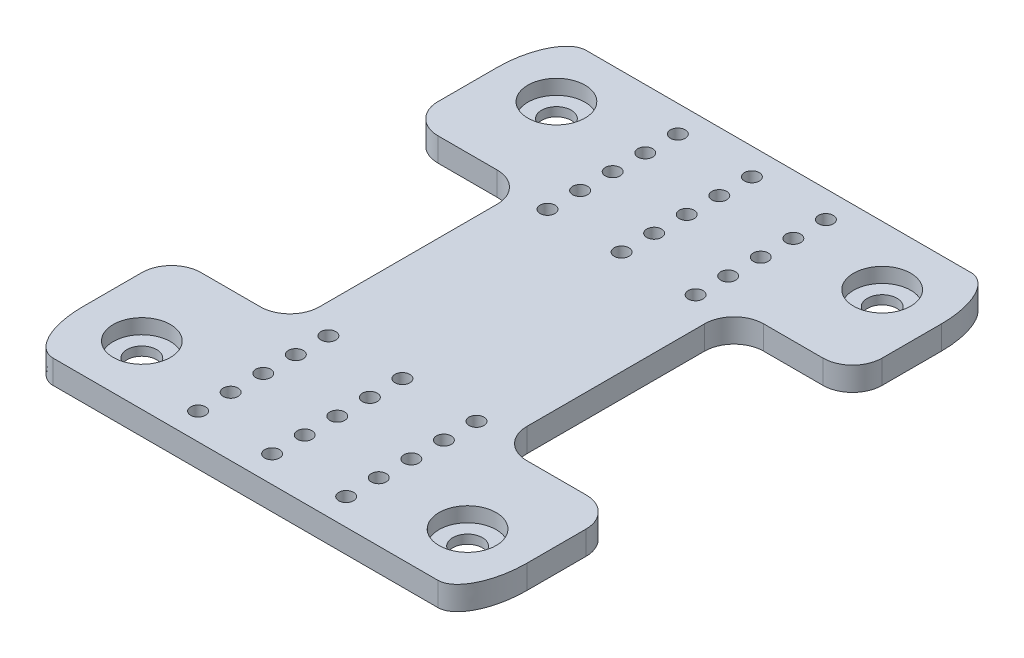
from build123d import *

# Parameters (mm, degrees)
SKETCH2_W               = 150
SKETCH2_H               = 180
BOSS_EXTRUDE1_DEPTH     = 4
FILLET1_SIZE            = 10
FILLET1_SIZE_2          = 20
FILLET2_SIZE            = 10
FILLET2_SIZE_2          = 20
SKETCH3_R               = 9.65
CUT_EXTRUDE1_DEPTH      = 5
SKETCH7_R               = 5
CUT_EXTRUDE4_DEPTH      = 118.426572949
MIRROR2_COPY_1_SKETCH_R = 9.65
MIRROR2_COPY_1_DEPTH    = 5
MIRROR2_COPY_2_SKETCH_R = 5
MIRROR2_COPY_2_DEPTH    = 118.426572949
SKETCH4_W               = 80
SKETCH4_H               = 80
CUT_EXTRUDE2_DEPTH      = 118.426572949
FILLET3_R               = 10
SKETCH6_R               = 2.5
CUT_EXTRUDE3_DEPTH      = 118.426572949


with BuildPart() as part:
    # Sketch2 → Boss-Extrude1 (new, symmetric)
    with BuildSketch(Plane(origin=(0, 0, 0), x_dir=(1, 0, 0), z_dir=(0, 1, 0))):
        Rectangle(SKETCH2_W, SKETCH2_H)
    extrude(amount=BOSS_EXTRUDE1_DEPTH, both=True)

    # Fillet1
    # an asymmetric fillet: 20, 10 mm, written as the material it takes off along each edge
    with BuildSketch(Plane(origin=(-75, -54, -90), x_dir=(1, 0, 0), z_dir=(0, 1, 0))) as fillet1_piece_1:
        with BuildLine():
            Bezier((FILLET1_SIZE, 0), (0, 0), (0, -FILLET1_SIZE_2), weights=[1, 0.707106781, 1])
            Line((0, -FILLET1_SIZE_2), (0, 0))
            Line((0, 0), (FILLET1_SIZE, 0))
        make_face()
    extrude(amount=108, mode=Mode.SUBTRACT)
    with BuildSketch(Plane(origin=(75, 54, 90), x_dir=(-1, 0, 0), z_dir=(0, -1, 0))) as fillet1_piece_2:
        with BuildLine():
            Bezier((FILLET1_SIZE, 0), (0, 0), (0, FILLET1_SIZE_2), weights=[1, 0.707106781, 1])
            Line((0, FILLET1_SIZE_2), (0, 0))
            Line((0, 0), (FILLET1_SIZE, 0))
        make_face()
    extrude(amount=108, mode=Mode.SUBTRACT)

    # Fillet2
    # an asymmetric fillet: 20, 10 mm, written as the material it takes off along each edge
    with BuildSketch(Plane(origin=(75, 54, -90), x_dir=(-1, 0, 0), z_dir=(0, -1, 0))) as fillet2_piece_1:
        with BuildLine():
            Bezier((FILLET2_SIZE, 0), (0, 0), (0, -FILLET2_SIZE_2), weights=[1, 0.707106781, 1])
            Line((0, -FILLET2_SIZE_2), (0, 0))
            Line((0, 0), (FILLET2_SIZE, 0))
        make_face()
    extrude(amount=108, mode=Mode.SUBTRACT)
    with BuildSketch(Plane(origin=(-75, -54, 90), x_dir=(0, 0, -1), z_dir=(0, 1, 0))) as fillet2_piece_2:
        with BuildLine():
            Bezier((FILLET2_SIZE_2, 0), (0, 0), (0, -FILLET2_SIZE), weights=[1, 0.707106781, 1])
            Line((0, -FILLET2_SIZE), (0, 0))
            Line((0, 0), (FILLET2_SIZE_2, 0))
        make_face()
    extrude(amount=108, mode=Mode.SUBTRACT)

    # Sketch3 → Cut-Extrude1 (cut)
    with BuildSketch(Plane(origin=(0, 4, 0), x_dir=(1, 0, 0), z_dir=(0, 1, 0))):
        with Locations(Location((-55, -70, 0), (0, 0, 270))):
            Circle(SKETCH3_R)
    cut_extrude1 = extrude(amount=-CUT_EXTRUDE1_DEPTH, mode=Mode.SUBTRACT)

    # Sketch7 → Cut-Extrude4 (cut, through all)
    with BuildSketch(Plane(origin=(0, 4, 0), x_dir=(1, 0, 0), z_dir=(0, 1, 0))):
        with Locations(Location((-55, -70, 0), (0, 0, 270))):
            Circle(SKETCH7_R)
    cut_extrude4 = extrude(amount=-CUT_EXTRUDE4_DEPTH, mode=Mode.SUBTRACT)

    # Mirror1: Cut-Extrude1, Cut-Extrude4 across plane
    add(cut_extrude1.mirror(Plane.XY), mode=Mode.SUBTRACT)
    add(cut_extrude4.mirror(Plane.XY), mode=Mode.SUBTRACT)

    # Mirror2: Cut-Extrude1, Cut-Extrude4 across plane
    add(cut_extrude1.mirror(Plane(origin=(0, 0, 0), x_dir=(0, 0, 1), z_dir=(1, 0, 0))), mode=Mode.SUBTRACT)
    add(cut_extrude4.mirror(Plane(origin=(0, 0, 0), x_dir=(0, 0, 1), z_dir=(1, 0, 0))), mode=Mode.SUBTRACT)

    # Mirror2 copy 1 sketch → Mirror2 copy 1 (cut)
    with BuildSketch(Plane(origin=(0, 4, 0), x_dir=(-1, 0, 0), z_dir=(0, 1, 0))):
        with Locations(Location((-55, -70, 0), (0, 0, 270))):
            Circle(MIRROR2_COPY_1_SKETCH_R)
    extrude(amount=-MIRROR2_COPY_1_DEPTH, mode=Mode.SUBTRACT)

    # Mirror2 copy 2 sketch → Mirror2 copy 2 (cut, through all)
    with BuildSketch(Plane(origin=(0, 4, 0), x_dir=(-1, 0, 0), z_dir=(0, 1, 0))):
        with Locations(Location((-55, -70, 0), (0, 0, 270))):
            Circle(MIRROR2_COPY_2_SKETCH_R)
    extrude(amount=-MIRROR2_COPY_2_DEPTH, mode=Mode.SUBTRACT)

    # Sketch4 → Cut-Extrude2 (cut, through all)
    with BuildSketch(Plane(origin=(0, 4, 0), x_dir=(1, 0, 0), z_dir=(0, 1, 0))):
        with Locations((-75, 0)):
            Rectangle(SKETCH4_W, SKETCH4_H)
    cut_extrude2 = extrude(amount=-CUT_EXTRUDE2_DEPTH, mode=Mode.SUBTRACT)

    # Mirror3: Cut-Extrude2 across plane
    add(cut_extrude2.mirror(Plane(origin=(0, 0, 0), x_dir=(0, 0, 1), z_dir=(1, 0, 0))), mode=Mode.SUBTRACT)

    # Fillet3
    fillet3_edges = [part.edges().sort_by_distance(p)[0] for p in [
        (75, 0, -40),
        (75, 0, 40),
        (-75, 0, -40),
        (-75, 0, 40),
        (-35, 0, -40),
        (-35, 0, 40),
        (35, 0, 40),
        (35, 0, -40),
    ]]
    fillet(fillet3_edges, radius=FILLET3_R)

    # Sketch6 → Cut-Extrude3 (cut, through all)
    with BuildSketch(Plane(origin=(0, 4, 0), x_dir=(1, 0, 0), z_dir=(0, 1, 0))):
        with Locations(Location((-25, 81, 0), (0, 0, 270))):
            Circle(SKETCH6_R)
        with Locations(Location((25, 81, 0), (0, 0, 270))):
            Circle(SKETCH6_R)
        with Locations(Location((0, 81, 0), (0, 0, 270))):
            Circle(SKETCH6_R)
        with Locations(Location((-25, 70, 0), (0, 0, 270))):
            Circle(SKETCH6_R)
        with Locations(Location((0, 70, 0), (0, 0, 270))):
            Circle(SKETCH6_R)
        with Locations(Location((25, 70, 0), (0, 0, 270))):
            Circle(SKETCH6_R)
        with Locations(Location((-25, 59, 0), (0, 0, 270))):
            Circle(SKETCH6_R)
        with Locations(Location((0, 59, 0), (0, 0, 270))):
            Circle(SKETCH6_R)
        with Locations(Location((25, 59, 0), (0, 0, 270))):
            Circle(SKETCH6_R)
        with Locations(Location((-25, 48, 0), (0, 0, 270))):
            Circle(SKETCH6_R)
        with Locations(Location((0, 48, 0), (0, 0, 270))):
            Circle(SKETCH6_R)
        with Locations(Location((25, 48, 0), (0, 0, 270))):
            Circle(SKETCH6_R)
        with Locations(Location((-25, 37, 0), (0, 0, 270))):
            Circle(SKETCH6_R)
        with Locations(Location((0, 37, 0), (0, 0, 270))):
            Circle(SKETCH6_R)
        with Locations(Location((25, 37, 0), (0, 0, 270))):
            Circle(SKETCH6_R)
    cut_extrude3 = extrude(amount=-CUT_EXTRUDE3_DEPTH, mode=Mode.SUBTRACT)

    # Mirror4: Cut-Extrude3 across plane
    add(cut_extrude3.mirror(Plane.XY), mode=Mode.SUBTRACT)


solid = part.part
